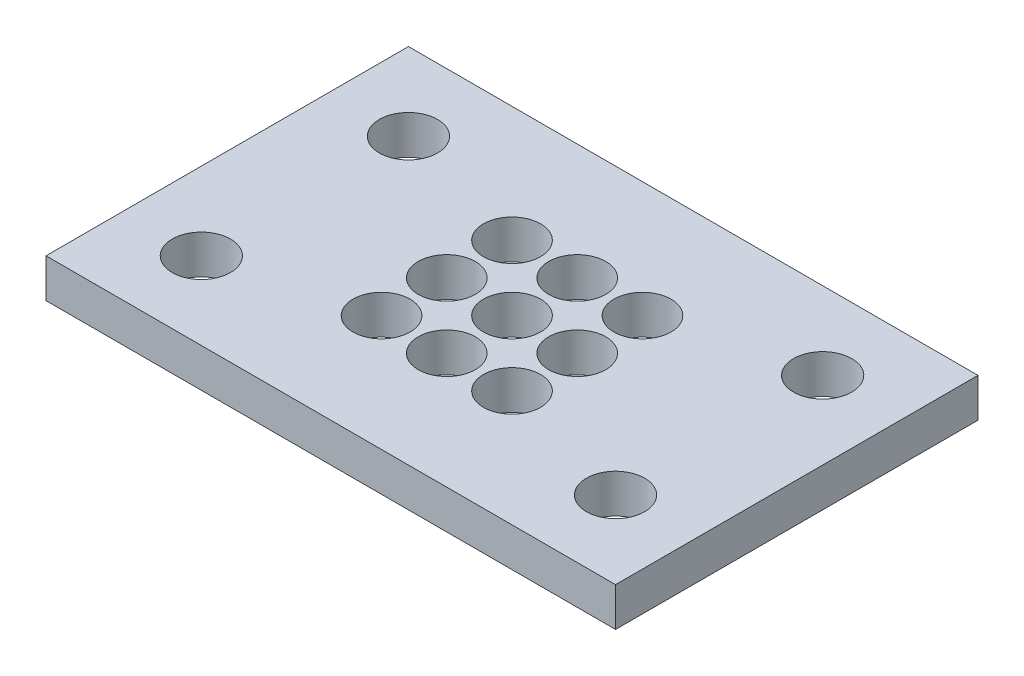
from build123d import *

# Parameters (mm, degrees)
SKETCH1_W           = 69.85
SKETCH1_H           = 44.45
SKETCH1_R           = 3.5687
SKETCH1_R_2         = 3.5
BOSS_EXTRUDE1_DEPTH = 4.7625


with BuildPart() as part:
    # Sketch1 → Boss-Extrude1 (new body)
    with BuildSketch(Plane(origin=(0, 0, 0), x_dir=(1, 0, 0), z_dir=(0, 1, 0))):
        with Locations((34.925, 22.225)):
            Rectangle(SKETCH1_W, SKETCH1_H)
        with Locations((9.525, 9.525)):
            Circle(SKETCH1_R, mode=Mode.SUBTRACT)
        with Locations((26.925, 14.225)):
            Circle(SKETCH1_R_2, mode=Mode.SUBTRACT)
        with Locations((26.925, 22.225)):
            Circle(SKETCH1_R_2, mode=Mode.SUBTRACT)
        with Locations((60.325, 9.525)):
            Circle(SKETCH1_R, mode=Mode.SUBTRACT)
        with Locations((34.925, 14.225)):
            Circle(SKETCH1_R_2, mode=Mode.SUBTRACT)
        with Locations((42.925, 14.225)):
            Circle(SKETCH1_R_2, mode=Mode.SUBTRACT)
        with Locations((26.925, 30.225)):
            Circle(SKETCH1_R_2, mode=Mode.SUBTRACT)
        with Locations((34.925, 30.225)):
            Circle(SKETCH1_R_2, mode=Mode.SUBTRACT)
        with Locations((9.525, 34.925)):
            Circle(SKETCH1_R, mode=Mode.SUBTRACT)
        with Locations((34.925, 22.225)):
            Circle(SKETCH1_R_2, mode=Mode.SUBTRACT)
        with Locations((42.925, 22.225)):
            Circle(SKETCH1_R_2, mode=Mode.SUBTRACT)
        with Locations((42.925, 30.225)):
            Circle(SKETCH1_R_2, mode=Mode.SUBTRACT)
        with Locations((60.325, 34.925)):
            Circle(SKETCH1_R, mode=Mode.SUBTRACT)
    extrude(amount=BOSS_EXTRUDE1_DEPTH)


solid = part.part
